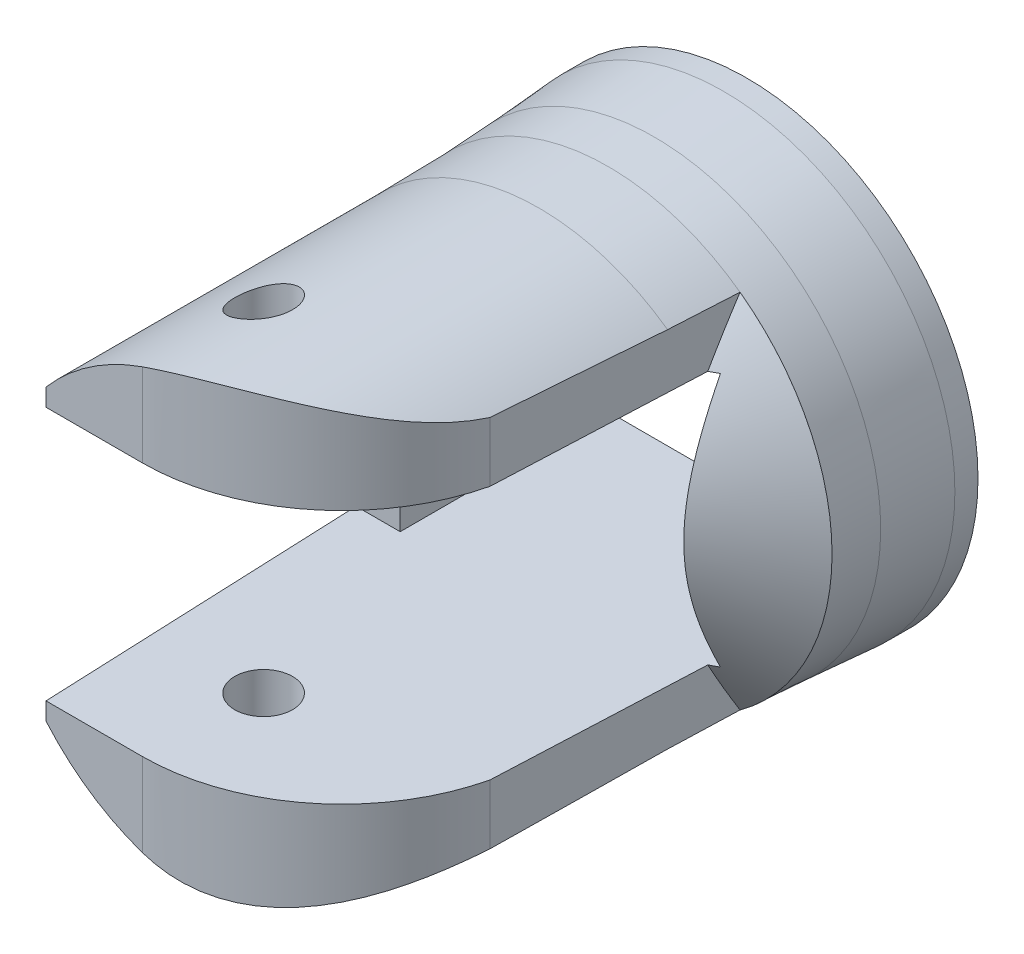
from build123d import *

# Parameters (mm, degrees)
SKETCH1_R               = 10
BOSS_EXTRUDE1_DEPTH     = 1
SKETCH2_R               = 10
BOSS_EXTRUDE2_DEPTH     = 3
BOSS_EXTRUDE2_TAPER     = 4
SKETCH3_R               = 9.790219564
BOSS_EXTRUDE3_DEPTH     = 2
BOSS_EXTRUDE3_TAPER     = 3
SKETCH4_R               = 9.685404006
BOSS_EXTRUDE4_DEPTH     = 3
BOSS_EXTRUDE4_TAPER     = 1
SKETCH5_R               = 9.633038811
BOSS_EXTRUDE5_DEPTH     = 14
CUT_EXTRUDE1_DEPTH      = 13
CUT_EXTRUDE1_DEPTH_BACK = 13
SKETCH6_W               = 17.15
SKETCH6_H               = 11
CUT_EXTRUDE2_DEPTH      = 13
CUT_EXTRUDE2_DEPTH_BACK = 13
SKETCH8_W               = 12
SKETCH8_H               = 11
CUT_EXTRUDE3_DEPTH      = 13
SKETCH9_R               = 1.25
CUT_EXTRUDE4_DEPTH      = 11
CHAMFER1_SIZE           = 4
CHAMFER1_SIZE_2         = 3


with BuildPart() as part:
    # Sketch1 → Boss-Extrude1 (new body)
    with BuildSketch(Plane.XY):
        Circle(SKETCH1_R)
    extrude(amount=BOSS_EXTRUDE1_DEPTH)

    # Sketch2 → Boss-Extrude2 (add)
    with BuildSketch(Plane.XY.offset(1)):
        Circle(SKETCH2_R)
    extrude(amount=BOSS_EXTRUDE2_DEPTH, taper=BOSS_EXTRUDE2_TAPER)

    # Sketch3 → Boss-Extrude3 (add)
    with BuildSketch(Plane.XY.offset(4)):
        Circle(SKETCH3_R)
    extrude(amount=BOSS_EXTRUDE3_DEPTH, taper=BOSS_EXTRUDE3_TAPER)

    # Sketch4 → Boss-Extrude4 (add)
    with BuildSketch(Plane.XY.offset(6)):
        Circle(SKETCH4_R)
    extrude(amount=BOSS_EXTRUDE4_DEPTH, taper=BOSS_EXTRUDE4_TAPER)

    # Sketch5 → Boss-Extrude5 (add)
    with BuildSketch(Plane.XY.offset(9)):
        Circle(SKETCH5_R)
    extrude(amount=BOSS_EXTRUDE5_DEPTH)

    # Sketch6 → Cut-Extrude1 (cut, two sides: drawn at the far end of the back side and taken through both)
    with BuildSketch(Plane(origin=(0, 0, 0), x_dir=(0, 0, -1), z_dir=(1, 0, 0)).offset(-CUT_EXTRUDE1_DEPTH_BACK)):
        with Locations((-17.575, 0)):
            Rectangle(SKETCH6_W, SKETCH6_H)
    extrude(amount=CUT_EXTRUDE1_DEPTH + CUT_EXTRUDE1_DEPTH_BACK, mode=Mode.SUBTRACT)

    # Sketch7 → Cut-Extrude2 (cut, two sides: drawn at the far end of the back side and taken through both)
    with BuildSketch(Plane(origin=(0, 0, 0), x_dir=(1, 0, 0), z_dir=(0, 1, 0)).offset(-CUT_EXTRUDE2_DEPTH_BACK)):
        with BuildLine():
            Line((-7.9085673, -9), (-9.6485673, -9))
            Line((-9.6485673, -9), (-9.6485673, -28.451581468))
            Line((-9.6485673, -28.451581468), (9.633038811, -28.451581468))
            Line((9.633038811, -28.451581468), (9.633038811, -9))
            Line((9.633038811, -9), (5.5714327, -9))
            Line((5.5714327, -9), (5.243186995, -16.36))
            ThreePointArc((5.243186995, -16.36), (2.198477753, -21.139438677), (-3.154241182, -23))
            Line((-3.154241182, -23), (-7.324241182, -23))
            Line((-7.324241182, -23), (-7.9085673, -9))
        make_face()
    extrude(amount=CUT_EXTRUDE2_DEPTH + CUT_EXTRUDE2_DEPTH_BACK, mode=Mode.SUBTRACT)

    # Sketch8 → Cut-Extrude3 (cut)
    with BuildSketch(Plane(origin=(0, 0, 0), x_dir=(-1, 0, 0), z_dir=(0, 0, -1))):
        Rectangle(SKETCH8_W, SKETCH8_H)
    extrude(amount=-CUT_EXTRUDE3_DEPTH, mode=Mode.SUBTRACT)

    # Sketch9 → Cut-Extrude4 (cut, symmetric)
    with BuildSketch(Plane(origin=(0, 0, 0), x_dir=(1, 0, 0), z_dir=(0, 1, 0))):
        with Locations(Location((-2.9085673, -18, 0), (0, 0, 270))):
            Circle(SKETCH9_R)
    extrude(amount=CUT_EXTRUDE4_DEPTH, both=True, mode=Mode.SUBTRACT)

    # Chamfer1
    # the kernel refuses this chamfer: 4, 3 mm, written as the material it takes off along each edge
    with BuildSketch(Plane(origin=(0, 0, 9), x_dir=(-0.4396306058143097, 0.8981786740016393, 0), z_dir=(-0.8981786740016393, -0.4396306058143097, 0))) as chamfer1_piece_1_section:
        Polygon((9.633038811 - CHAMFER1_SIZE, 0), (9.633038811 + CHAMFER1_SIZE_2 * 0.0174524064373, CHAMFER1_SIZE_2 * 0.999847695156), (9.633038811, 0), align=None)
    chamfer1_piece_1 = revolve(axis=Axis((0, 0, 9), (0, 0, -1)), revolution_arc=116.080314714, mode=Mode.PRIVATE)
    chamfer1_piece_1 = split(chamfer1_piece_1, bisect_by=Plane(origin=(5.560372923, 0, 9.247984855), z_dir=(0.9990069635270564, 0, 0.04455431319693658)), keep=Keep.TOP, mode=Mode.PRIVATE)
    add(chamfer1_piece_1, mode=Mode.SUBTRACT)
    with BuildSketch(Plane(origin=(0, 0, 9), x_dir=(1, 0, 0), z_dir=(0, 1, 0))) as chamfer1_piece_2_section:
        Polygon((9.633038811 - CHAMFER1_SIZE, 0), (9.633038811 + CHAMFER1_SIZE_2 * 0.0174524064373, CHAMFER1_SIZE_2 * 0.999847695156), (9.633038811, 0), align=None)
    chamfer1_piece_2 = revolve(axis=Axis((0, 0, 9), (0, 0, -1)), revolution_arc=116.080314714, mode=Mode.PRIVATE)
    chamfer1_piece_2 = split(chamfer1_piece_2, bisect_by=Plane(origin=(5.560372923, 0, 9.247984855), z_dir=(0.9990069635270564, 0, 0.04455431319693658)), keep=Keep.TOP, mode=Mode.PRIVATE)
    add(chamfer1_piece_2, mode=Mode.SUBTRACT)


solid = part.part
